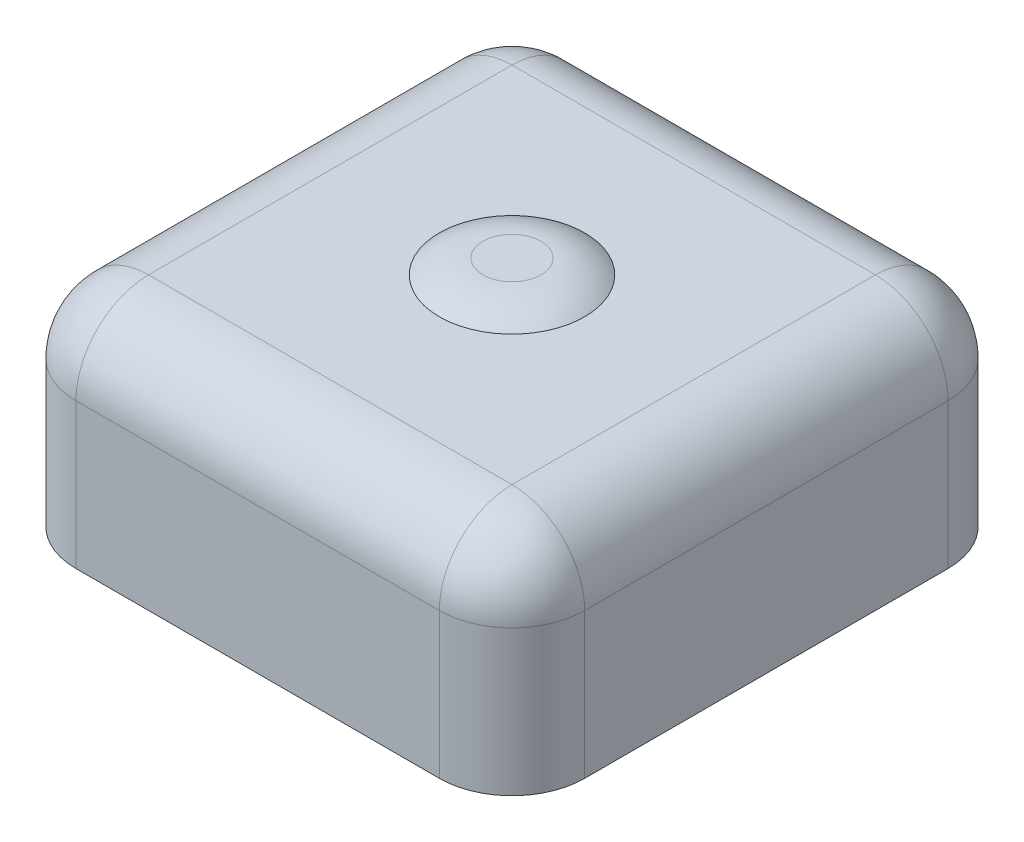
from build123d import *

# Parameters (mm, degrees)
SKETCH1_W           = 7
SKETCH1_H           = 7
BOSS_EXTRUDE1_DEPTH = 3
FILLET1_R           = 1
SKETCH2_R           = 1
BOSS_EXTRUDE2_DEPTH = 0.2
FILLET2_R           = 1


with BuildPart() as part:
    # Sketch1 → Boss-Extrude1 (new body)
    with BuildSketch(Plane(origin=(0, 0, 0), x_dir=(1, 0, 0), z_dir=(0, 1, 0))):
        Rectangle(SKETCH1_W, SKETCH1_H)
    extrude(amount=BOSS_EXTRUDE1_DEPTH)

    # Fillet1
    fillet1_edges = [part.edges().sort_by_distance(p)[0] for p in [
        (-3.5, 3, 0),
        (0, 3, 3.5),
        (3.5, 3, 0),
        (0, 3, -3.5),
        (3.5, 1.5, 3.5),
        (-3.5, 1.5, 3.5),
        (-3.5, 1.5, -3.5),
        (3.5, 1.5, -3.5),
    ]]
    fillet(fillet1_edges, radius=FILLET1_R)

    # Sketch2 → Boss-Extrude2 (add)
    with BuildSketch(Plane(origin=(0, 3, 0), x_dir=(1, 0, 0), z_dir=(0, 1, 0))):
        with Locations(Location((0, 0, 0), (0, 0, 270))):
            Circle(SKETCH2_R)
    extrude(amount=BOSS_EXTRUDE2_DEPTH)

    # Fillet2
    # the kernel refuses this fillet: 1 mm, written as the material it takes off along each edge
    with BuildSketch(Plane(origin=(0, 3.2, 0), x_dir=(0, 0, 1), z_dir=(-1, 0, 0))) as fillet2_piece_1:
        with BuildLine():
            CenterArc((0.4, -1), FILLET2_R, 53.130102354, 36.869897646)
            Line((0.4, 0), (0.4, 0.02))
            Line((0.4, 0.02), (1, 0.02))
            Line((1, 0.02), (1.02, 0))
            ThreePointArc((1.02, 0), (1.02, -0.1), (1.012, -0.184))
            Line((1.012, -0.184), (1, -0.2))
        make_face()
    revolve(axis=Axis((0, 3.2, 0), (0, 1, 0)), mode=Mode.SUBTRACT)


solid = part.part
